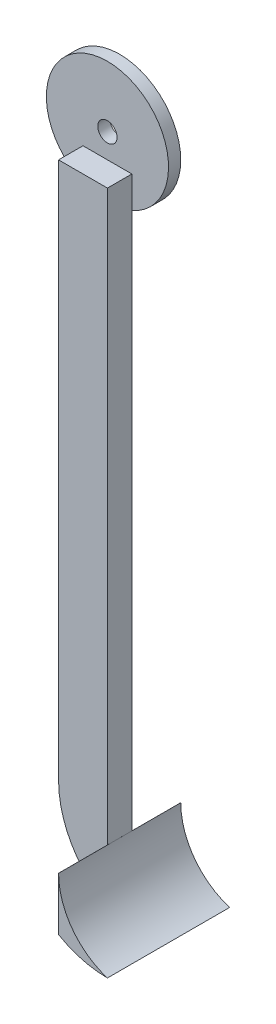
from build123d import *

# Parameters (mm, degrees)
BOSS_EXTRUDE5_DEPTH  = 2.5
BOSS_EXTRUDE6_DEPTH  = 5
BOSS_EXTRUDE10_DEPTH = 10
CUT_EXTRUDE2_DEPTH   = 139.087836629
FILLET2_R            = 20


with BuildPart() as part:
    # Sketch3 → Boss-Extrude5 (new body)
    with BuildSketch(Plane.XY):
        with BuildLine():
            ThreePointArc((0, 1.975), (1.396535893, 1.396535893), (1.975, 0))
            Line((1.975, 0), (12.5, 0))
            ThreePointArc((12.5, 0), (8.838834765, 8.838834765), (0, 12.5))
            Line((0, 12.5), (0, 1.975))
        make_face()
        with BuildLine():
            Line((12.5, 0), (1.975, 0))
            ThreePointArc((1.975, 0), (1.396535893, -1.396535893), (0, -1.975))
            Line((0, -1.975), (0, -12.5))
            ThreePointArc((0, -12.5), (8.838834765, -8.838834765), (12.5, 0))
        make_face()
        with BuildLine():
            ThreePointArc((0, -1.975), (-1.396535893, -1.396535893), (-1.975, 0))
            Line((-1.975, 0), (-12.5, 0))
            ThreePointArc((-12.5, 0), (-8.838834765, -8.838834765), (0, -12.5))
            Line((0, -12.5), (0, -1.975))
        make_face()
        with BuildLine():
            Line((-12.5, 0), (-1.975, 0))
            ThreePointArc((-1.975, 0), (-1.396535893, 1.396535893), (0, 1.975))
            Line((0, 1.975), (0, 12.5))
            ThreePointArc((0, 12.5), (-8.838834765, 8.838834765), (-12.5, 0))
        make_face()
    extrude(amount=BOSS_EXTRUDE5_DEPTH)

    # Sketch5 → Boss-Extrude6 (add)
    with BuildSketch(Plane.XY.offset(2.5)):
        Polygon((-5, -134.975), (-5, -4.975), (0, -4.975), (5, -4.975), (5, -134.975), align=None)
    extrude(amount=BOSS_EXTRUDE6_DEPTH)

    # Sketch13 → Boss-Extrude10 (add)
    with BuildSketch(Plane(origin=(5, 0, 0), x_dir=(0, 0, -1), z_dir=(1, 0, 0))):
        Polygon((-7.5, -134.975), (-17.5, -134.975), (-17.5, -121.403681616), (-7.5, -121.403681616), (-2.5, -121.403681616), (7.5, -121.403681616), (7.5, -134.975), (-2.5, -134.975), align=None)
    extrude(amount=BOSS_EXTRUDE10_DEPTH)

    # Sketch14 → Cut-Extrude2 (cut, through all)
    with BuildSketch(Plane(origin=(0, 0, -7.5), x_dir=(-1, 0, 0), z_dir=(0, 0, -1))):
        with BuildLine():
            Line((-15, -134.975), (-15, -121.403681616))
            Line((-15, -121.403681616), (-5.003644464, -121.4036816))
            ThreePointArc((-5.003644464, -121.4036816), (-7.772477519, -129.831430515), (-15, -134.975))
        make_face()
    extrude(amount=-CUT_EXTRUDE2_DEPTH, mode=Mode.SUBTRACT)

    # Fillet2
    fillet2_edges = [part.edges().sort_by_distance(p)[0] for p in [
        (-5, -134.975, 5),
    ]]
    fillet(fillet2_edges, radius=FILLET2_R - 0.0001)  # a hair under: the kernel refuses the full size


solid = part.part
